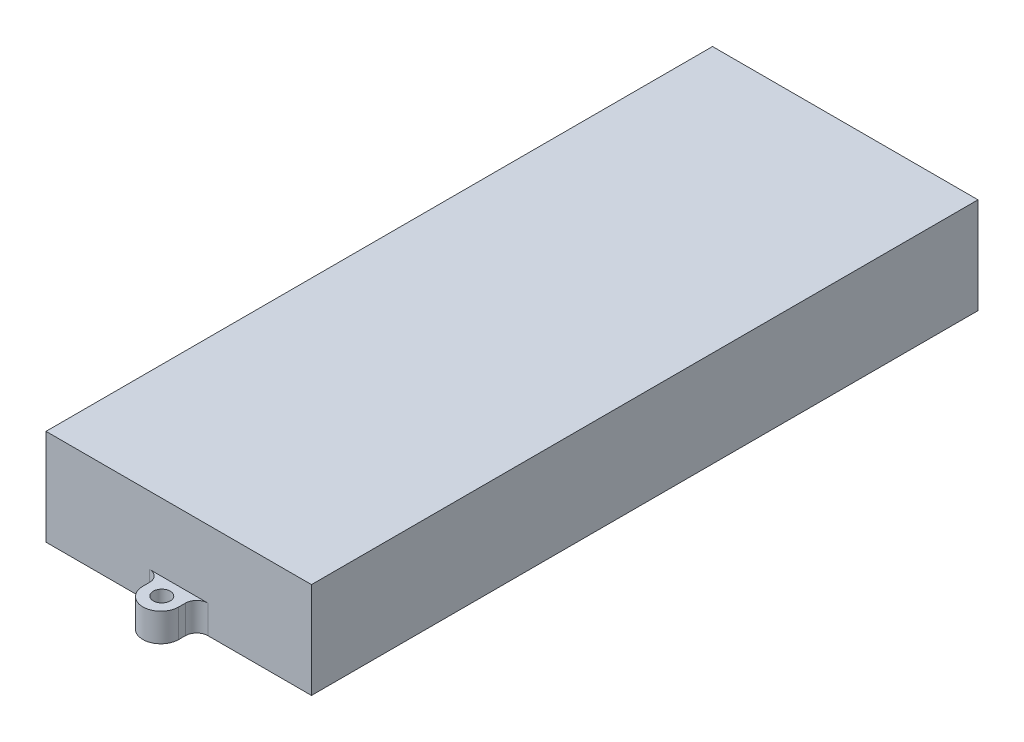
from build123d import *

# Parameters (mm, degrees)
SKETCH1_W           = 47
SKETCH1_H           = 118
BOSS_EXTRUDE1_DEPTH = 17
BOSS_EXTRUDE2_DEPTH = 5
SKETCH3_R           = 1.5
CUT_EXTRUDE1_DEPTH  = 71.476042028
FILLET2_R           = 2


with BuildPart() as part:
    # Sketch1 → Boss-Extrude1 (new body)
    with BuildSketch(Plane(origin=(0, 0, 0), x_dir=(1, 0, 0), z_dir=(0, 1, 0))):
        Rectangle(SKETCH1_W, SKETCH1_H)
    extrude(amount=BOSS_EXTRUDE1_DEPTH)

    # Sketch2 → Boss-Extrude2 (add)
    with BuildSketch(Plane(origin=(0, 0, 0), x_dir=(1, 0, 0), z_dir=(0, 1, 0))):
        with BuildLine():
            Line((-3.175, 62.175), (-3.175, 59))
            Line((-3.175, 59), (3.175, 59))
            Line((3.175, 59), (3.175, 62.175))
            ThreePointArc((3.175, 62.175), (0, 65.35), (-3.175, 62.175))
        make_face()
        with BuildLine():
            Line((3.175, -62.175), (3.175, -59))
            Line((3.175, -59), (-3.175, -59))
            Line((-3.175, -59), (-3.175, -62.175))
            ThreePointArc((-3.175, -62.175), (0, -65.35), (3.175, -62.175))
        make_face()
    extrude(amount=BOSS_EXTRUDE2_DEPTH)

    # Sketch3 → Cut-Extrude1 (cut, through all)
    with BuildSketch(Plane(origin=(0, 5, 0), x_dir=(1, 0, 0), z_dir=(0, 1, 0))):
        with Locations((0, -62)):
            Circle(SKETCH3_R)
        with Locations((0, 62)):
            Circle(SKETCH3_R)
    extrude(amount=-CUT_EXTRUDE1_DEPTH, mode=Mode.SUBTRACT)

    # Fillet2
    fillet2_edges = [part.edges().sort_by_distance(p)[0] for p in [
        (3.175, 2.5, -59),
        (-3.175, 2.5, -59),
        (-3.175, 2.5, 59),
        (3.175, 2.5, 59),
    ]]
    fillet(fillet2_edges, radius=FILLET2_R)


solid = part.part
